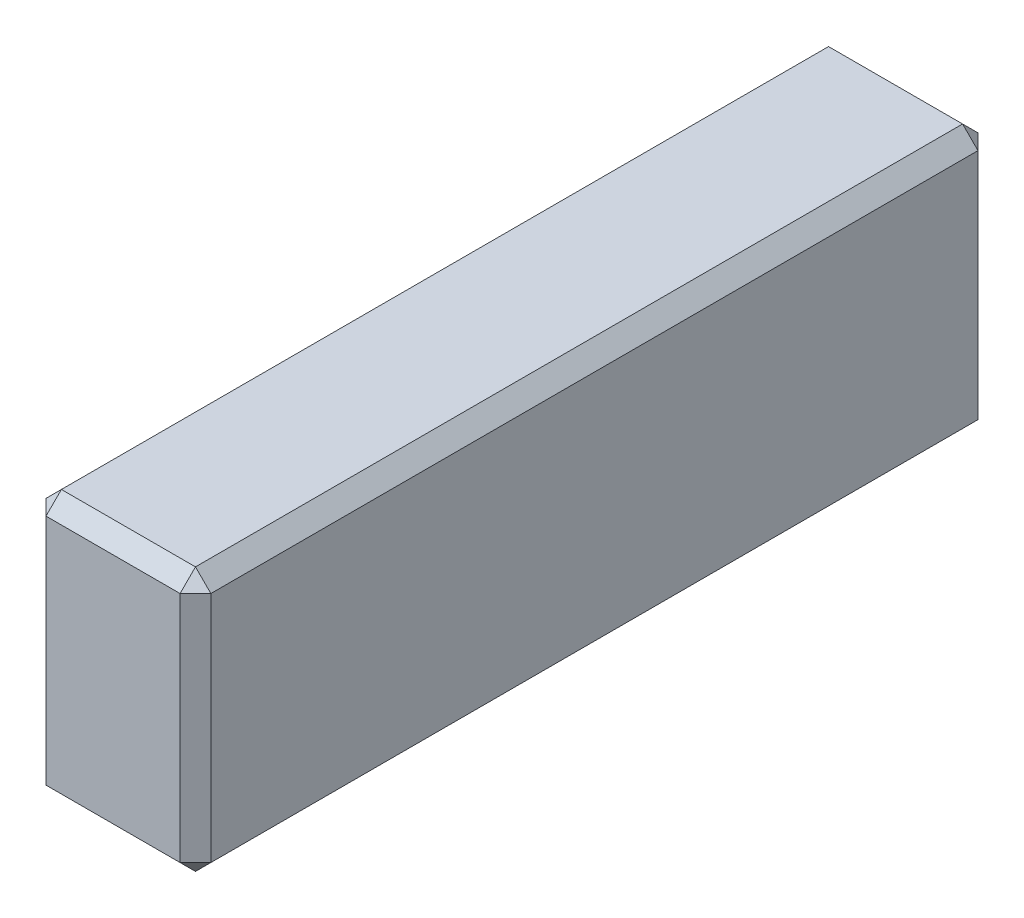
from build123d import *

# Parameters (mm, degrees)
SKETCH1_W                       = 75
SKETCH1_H                       = 120
BOSS_EXTRUDE1_DEPTH             = 181.5
SKETCH2_W                       = 24
SKETCH2_H                       = 50
CUT_EXTRUDE1_DEPTH              = 15
SHELL1_START                    = -22.5
SHELL1_OUTLINE_W                = 94
SHELL1_OUTLINE_H                = 337
SHELL1_DEPTH                    = 47
SHELL1_START_2                  = -24.5
SHELL1_2_DEPTH                  = 2
BOSS_EXTRUDE2_REACH             = 196.804
SKETCH3_W                       = 45
SKETCH3_H                       = 13
BOSS_EXTRUDE2_DIRECTION_2_REACH = 196.804
CHAMFER1_SIZE                   = 7
CUT_EXTRUDE2_START              = -62
SKETCH4_W                       = 24
SKETCH4_H                       = 104.028076608
CUT_EXTRUDE2_DEPTH              = 49


# Read off the part's stored shape, not the designer's step: Shell1
with BuildPart() as part:
    # Sketch1 → Boss-Extrude1 (new, symmetric)
    with BuildSketch(Plane.XY):
        Rectangle(SKETCH1_W, SKETCH1_H)
    extrude(amount=BOSS_EXTRUDE1_DEPTH, both=True)

    # Sketch2 → Cut-Extrude1 (cut)
    with BuildSketch(Plane(origin=(-37.5, 0, 131.5), x_dir=(0, 0, -1), z_dir=(1, 0, 0))):
        with Locations((131.5, -35)):
            Rectangle(SKETCH2_W, SKETCH2_H)
    extrude(amount=CUT_EXTRUDE1_DEPTH, mode=Mode.SUBTRACT)

    # Shell1 outline → Shell1 (cut)
    with BuildSketch(Plane.YZ.offset(SHELL1_START)):
        Rectangle(SHELL1_OUTLINE_W, SHELL1_OUTLINE_H)
    extrude(amount=SHELL1_DEPTH, mode=Mode.SUBTRACT)

    # Shell1 2 outline → Shell1 2 (cut)
    with BuildSketch(Plane.YZ.offset(SHELL1_START_2)):
        Polygon((-47, -25), (-47, -168.5), (47, -168.5), (47, 168.5), (-47, 168.5), (-47, 25), (3, 25), (3, -25), align=None)
    extrude(amount=SHELL1_2_DEPTH, mode=Mode.SUBTRACT)

    # Sketch3 → Boss-Extrude2 (add, up to next)
    with BuildSketch(Plane.XY, mode=Mode.PRIVATE) as boss_extrude2_sk1:
        Rectangle(SKETCH3_W, SKETCH3_H)
    boss_extrude2_tool1 = extrude(boss_extrude2_sk1.sketch, amount=-BOSS_EXTRUDE2_REACH, mode=Mode.PRIVATE) - part.part
    add(boss_extrude2_tool1.solids().sort_by_distance((0, 0, 0))[0])

    # Sketch3 → Boss-Extrude2 direction 2 (add, up to next)
    with BuildSketch(Plane.XY, mode=Mode.PRIVATE) as boss_extrude2_direction_2_sk1:
        Rectangle(SKETCH3_W, SKETCH3_H)
    boss_extrude2_direction_2_tool1 = extrude(boss_extrude2_direction_2_sk1.sketch, amount=BOSS_EXTRUDE2_DIRECTION_2_REACH, mode=Mode.PRIVATE) - part.part
    add(boss_extrude2_direction_2_tool1.solids().sort_by_distance((0, 0, 0))[0])

    # Chamfer1
    chamfer1_edges = [part.edges().sort_by_distance(p)[0] for p in [
        (0, -60, 181.5),
        (37.5, 0, 181.5),
        (0, 60, 181.5),
        (37.5, 0, -181.5),
        (0, -60, -181.5),
        (-37.5, 0, -181.5),
        (0, 60, -181.5),
        (-37.5, 0, 181.5),
        (37.5, 60, 0),
        (37.5, -60, 0),
        (-37.5, -60, 96.75),
        (-37.5, 60, 0),
    ]]
    chamfer(chamfer1_edges, length=CHAMFER1_SIZE)

    # Sketch4 → Cut-Extrude2 (cut)
    with BuildSketch(Plane.ZY.offset(37.5).offset(CUT_EXTRUDE2_START)):
        with Locations((0, -20.489530189)):
            Rectangle(SKETCH4_W, SKETCH4_H)
    extrude(amount=CUT_EXTRUDE2_DEPTH, mode=Mode.SUBTRACT)


solid = part.part
